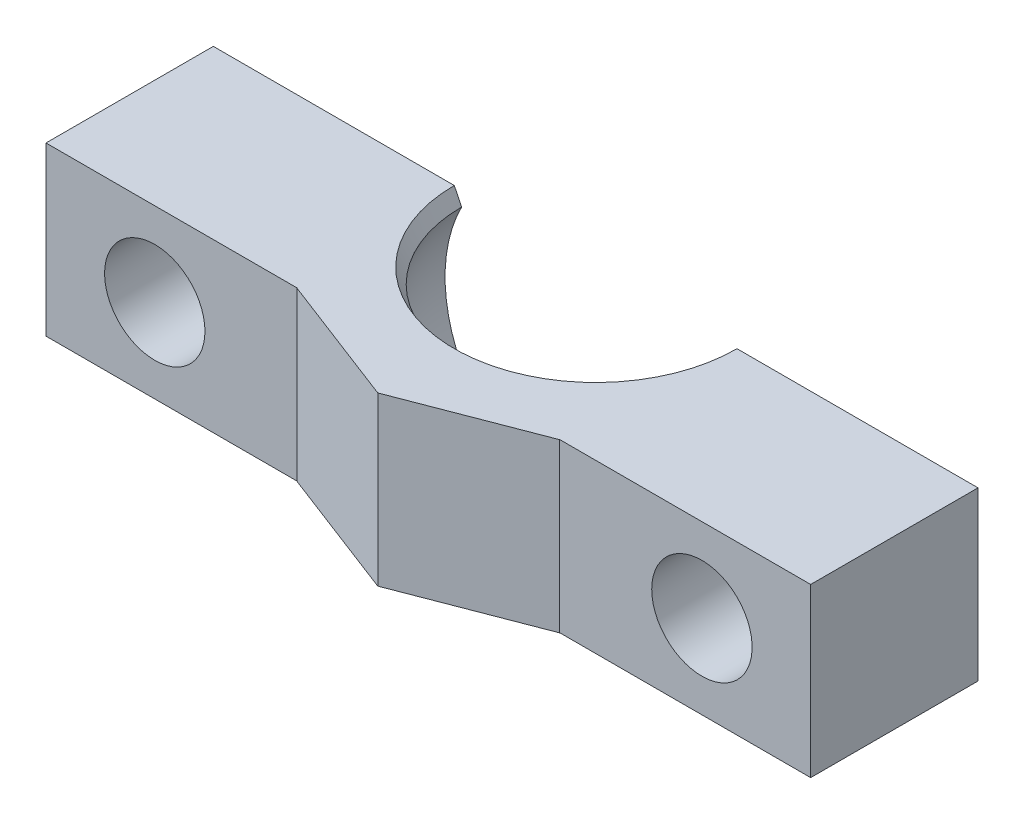
from build123d import *

# Parameters (mm, degrees)
SKETCH2_W           = 45.7
SKETCH2_H           = 15
BOSS_EXTRUDE1_DEPTH = 10
SKETCH4_R           = 3
CUT_EXTRUDE1_DEPTH  = 50.127283662
SKETCH5_W           = 15
SKETCH5_H           = 10
CUT_EXTRUDE2_DEPTH  = 5
CHAMFER1_SIZE       = 4.990232455
CHAMFER1_SIZE_2     = 13
CHAMFER2_SIZE       = 0.965614075


with BuildPart() as part:
    # Sketch2 → Boss-Extrude1 (new body)
    with BuildSketch(Plane(origin=(0, 0, 0), x_dir=(1, 0, 0), z_dir=(0, 1, 0))):
        with Locations((-22.85, -7.5)):
            Rectangle(SKETCH2_W, SKETCH2_H)
    extrude(amount=BOSS_EXTRUDE1_DEPTH)

    # Sketch3 → Cut-Revolve1 (revolve, cut)
    with BuildSketch(Plane(origin=(0, 0, 0), x_dir=(-1, 0, 0), z_dir=(0, 0, -1))):
        with BuildLine():
            Line((22.85, 14), (22.85, -4))
            ThreePointArc((22.85, -4), (13.85, 5), (22.85, 14))
        make_face()
    revolve(axis=Axis((-22.85, 14, 0), (0, -1, 0)), mode=Mode.SUBTRACT)

    # Sketch4 → Cut-Extrude1 (cut, through all)
    with BuildSketch(Plane(origin=(0, 0, 0), x_dir=(-1, 0, 0), z_dir=(0, 0, -1))):
        with Locations((6.5, 5)):
            Circle(SKETCH4_R)
        with Locations((39.2, 5)):
            Circle(SKETCH4_R)
    extrude(amount=-CUT_EXTRUDE1_DEPTH, mode=Mode.SUBTRACT)

    # Sketch5 → Cut-Extrude2 (cut)
    with BuildSketch(Plane.XY.offset(15)):
        with Locations((-38.2, 5)):
            Rectangle(SKETCH5_W, SKETCH5_H)
        with Locations((-7.5, 5)):
            Rectangle(SKETCH5_W, SKETCH5_H)
    extrude(amount=-CUT_EXTRUDE2_DEPTH, mode=Mode.SUBTRACT)

    # Chamfer1
    # the kernel refuses this chamfer: 13, 4.990232455 mm, written as the material it takes off along each edge
    with BuildSketch(Plane(origin=(-15, 43.716873314, 15), x_dir=(0, 0, -1), z_dir=(0, -1, 0))) as chamfer1_piece_1:
        Polygon((CHAMFER1_SIZE, 0), (0, -CHAMFER1_SIZE_2), (0, 0), align=None)
    extrude(amount=77.433746627, mode=Mode.SUBTRACT)
    with BuildSketch(Plane(origin=(-30.7, 43.716873314, 15), x_dir=(1, 0, 0), z_dir=(0, -1, 0))) as chamfer1_piece_2:
        Polygon((CHAMFER1_SIZE_2, 0), (0, -CHAMFER1_SIZE), (0, 0), align=None)
    extrude(amount=77.433746627, mode=Mode.SUBTRACT)

    # Chamfer2
    # the kernel refuses this chamfer: 1, 0.965614075 mm, written as the material it takes off along each edge
    with BuildSketch(Plane(origin=(-22.85, 0, 0), x_dir=(-0.9379115380464662, 0, -0.34687454043113636), z_dir=(0.34687454043113636, 0, -0.9379115380464662))) as chamfer2_piece_1:
        with BuildLine():
            Line((7.483314774 + CHAMFER2_SIZE, 0), (8.008407714, 0.893248743))
            ThreePointArc((8.008407714, 0.893248743), (7.764305072, 0.44856432), (7.483314774, 0))
            Line((7.483314774, 0), (7.483314774 + CHAMFER2_SIZE, 0))
        make_face()
    revolve(axis=Axis((-22.85, 0, 0), (0, 1, 0)), revolution_arc=220.592533512, mode=Mode.SUBTRACT)
    with BuildSketch(Plane(origin=(-22.85, 10, 0), x_dir=(-0.9379115380464663, 0, -0.3468745404311359), z_dir=(0.3468745404311359, 0, -0.9379115380464663))) as chamfer2_piece_2:
        with BuildLine():
            Line((8.008407714, -0.893248743), (7.483314774 + CHAMFER2_SIZE, 0))
            Line((7.483314774 + CHAMFER2_SIZE, 0), (7.483314774, 0))
            ThreePointArc((7.483314774, 0), (7.764305072, -0.44856432), (8.008407714, -0.893248743))
        make_face()
    revolve(axis=Axis((-22.85, 10, 0), (0, 1, 0)), revolution_arc=220.592533512, mode=Mode.SUBTRACT)


solid = part.part
